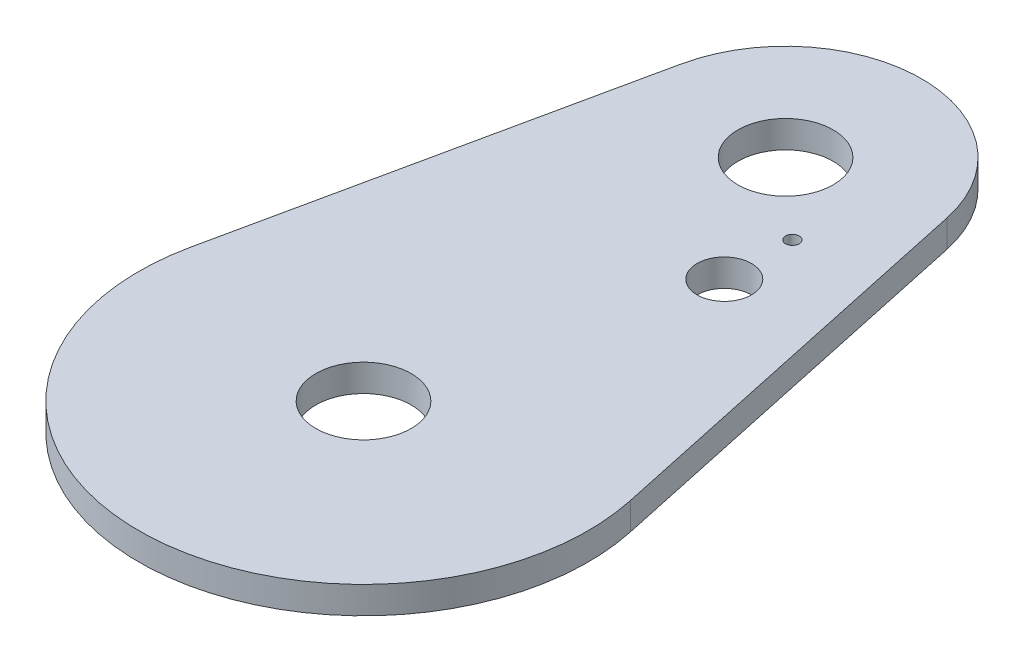
from build123d import *

# Parameters (mm, degrees)
SCHIZZO1_R          = 7
SCHIZZO1_R_2        = 1
SCHIZZO1_R_3        = 4
BASE_FLANGIA1_DEPTH = 4


# Sheet-metal steps are written as plain solids
with BuildPart() as part:
    # Schizzo1 → Base-Flangia1 (new body)
    with BuildSketch(Plane(origin=(0, 0, 0), x_dir=(1, 0, 0), z_dir=(0, 1, 0))):
        with BuildLine():
            Line((-19.555412344, 66.193548387), (-32.266430367, 6.919354839))
            ThreePointArc((-32.266430367, 6.919354839), (0, -33), (32.266430367, 6.919354839))
            Line((32.266430367, 6.919354839), (19.555412344, 66.193548387))
            ThreePointArc((19.555412344, 66.193548387), (0, 82), (-19.555412344, 66.193548387))
        make_face()
        with Locations(Location((0, 62, 0), (0, 0, 270))):
            Circle(SCHIZZO1_R, mode=Mode.SUBTRACT)
        with Locations(Location((0, 0, 0), (0, 0, 270))):
            Circle(SCHIZZO1_R, mode=Mode.SUBTRACT)
        with Locations(Location((11, 52, 0), (0, 0, 270))):
            Circle(SCHIZZO1_R_2, mode=Mode.SUBTRACT)
        with Locations(Location((11, 42, 0), (0, 0, 270))):
            Circle(SCHIZZO1_R_3, mode=Mode.SUBTRACT)
    extrude(amount=-BASE_FLANGIA1_DEPTH)


solid = part.part
